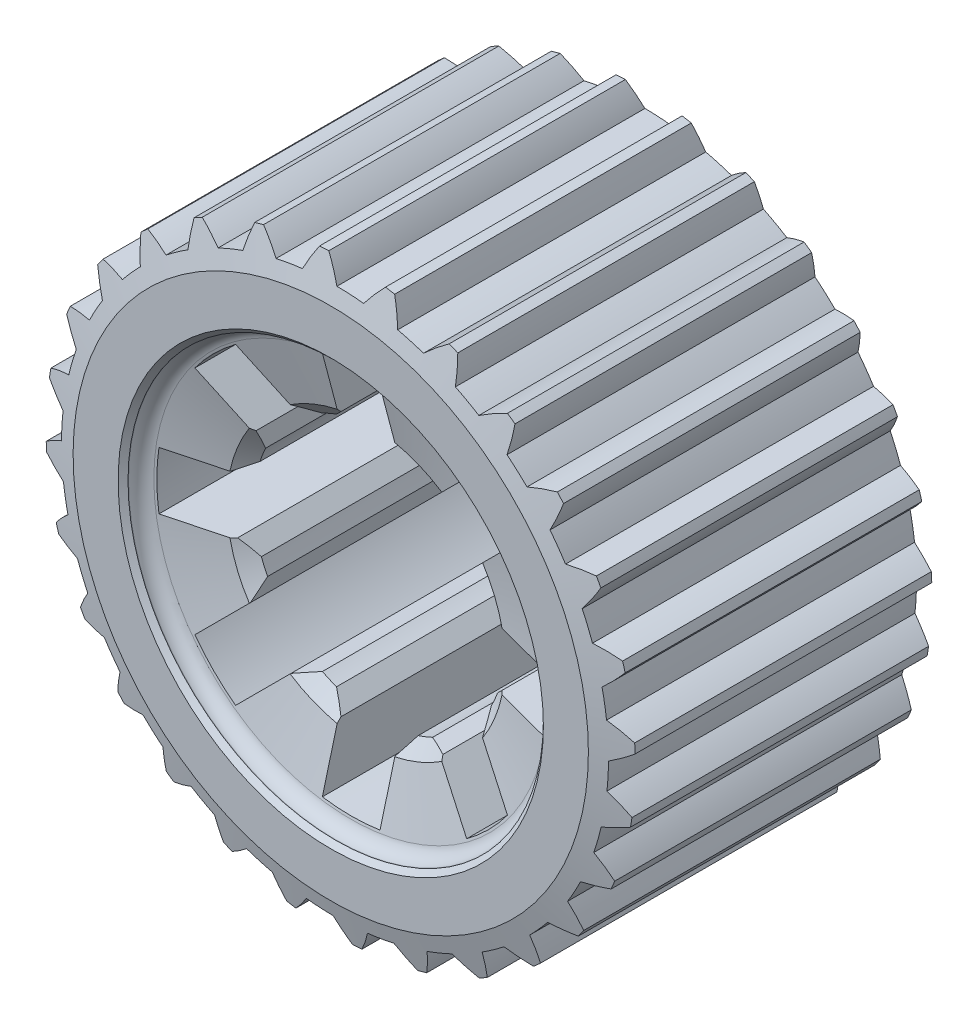
from build123d import *

# Parameters (mm, degrees)
CUT_EXTRUDE1_REACH = 54.916
CUT_EXTRUDE2_DEPTH = 32
CHAMFER1_SIZE      = 1.344493339
CHAMFER1_SIZE_2    = 1


with BuildPart() as part:
    # Sketch1 → Revolve1 (revolve)
    with BuildSketch(Plane(origin=(0, 0, 0), x_dir=(0, 0, -1), z_dir=(1, 0, 0)), mode=Mode.PRIVATE) as revolve1_sk:
        with BuildLine():
            Line((1.004809472, 29.8), (30.995190528, 29.8))
            Line((30.995190528, 29.8), (32, 26.05))
            Line((32, 26.05), (32, 21.5))
            Line((32, 21.5), (31.5, 21))
            Line((31.5, 21), (31.448888739, 21))
            ThreePointArc((31.448888739, 21), (30.535746596, 20.69003001), (30, 19.888228568))
            Line((30, 19.888228568), (28.44904883, 14.1))
            Line((28.44904883, 14.1), (27.04904883, 12.7))
            Line((27.04904883, 12.7), (4.92608004, 12.7))
            Line((4.92608004, 12.7), (3.560054636, 14.066025404))
            Line((3.560054636, 14.066025404), (2, 19.888228568))
            ThreePointArc((2, 19.888228568), (1.464253404, 20.69003001), (0.551111261, 21))
            Line((0.551111261, 21), (0.5, 21))
            Line((0.5, 21), (0, 21.5))
            Line((0, 21.5), (0, 26.05))
            Line((0, 26.05), (1.004809472, 29.8))
        make_face()
    revolve(revolve1_sk.sketch.rotate(Axis((0, 0, 0), (0, 0, -1)), 90), axis=Axis((0, 0, 0), (0, 0, -1)))

    # Cut-Extrude1: up to this face of the body (flat: up to its plane)
    cut_extrude1_end = Plane(part.part.faces().sort_by_distance((-25.313194734, 0, -32))[0])
    # Sketch2 → Cut-Extrude1 (cut, up to the picked face)
    with BuildSketch(Plane.XY, mode=Mode.PRIVATE) as cut_extrude1_sk1:
        with BuildLine():
            ThreePointArc((-12.360937464, 2.915), (-12.7, 0), (-12.360937464, -2.915))
            Line((-12.360937464, -2.915), (-19.432582819, -2.915))
            ThreePointArc((-19.432582819, -2.915), (-19.65, 0), (-19.432582819, 2.915))
            Line((-19.432582819, 2.915), (-12.360937464, 2.915))
        make_face()
    cut_extrude1_tool1 = split(extrude(cut_extrude1_sk1.sketch, amount=-CUT_EXTRUDE1_REACH, mode=Mode.PRIVATE), bisect_by=cut_extrude1_end, keep=Keep.BOTH, mode=Mode.PRIVATE)
    # Sketch2 → Cut-Extrude1 (cut, up to the picked face)
    with BuildSketch(Plane.XY, mode=Mode.PRIVATE) as cut_extrude1_sk2:
        with BuildLine():
            Line((-6.679286436, 10.80171897), (-11.67969482, 15.802127354))
            ThreePointArc((-11.67969482, 15.802127354), (-13.89464825, 13.89464825), (-15.802127354, 11.67969482))
            Line((-15.802127354, 11.67969482), (-10.80171897, 6.679286436))
            ThreePointArc((-10.80171897, 6.679286436), (-8.980256121, 8.980256121), (-6.679286436, 10.80171897))
        make_face()
    cut_extrude1_tool2 = split(extrude(cut_extrude1_sk2.sketch, amount=-CUT_EXTRUDE1_REACH, mode=Mode.PRIVATE), bisect_by=cut_extrude1_end, keep=Keep.BOTH, mode=Mode.PRIVATE)
    # Sketch2 → Cut-Extrude1 (cut, up to the picked face)
    with BuildSketch(Plane.XY, mode=Mode.PRIVATE) as cut_extrude1_sk3:
        with BuildLine():
            Line((2.915, 12.360937464), (2.915, 19.432582819))
            ThreePointArc((2.915, 19.432582819), (0, 19.65), (-2.915, 19.432582819))
            Line((-2.915, 19.432582819), (-2.915, 12.360937464))
            ThreePointArc((-2.915, 12.360937464), (0, 12.7), (2.915, 12.360937464))
        make_face()
    cut_extrude1_tool3 = split(extrude(cut_extrude1_sk3.sketch, amount=-CUT_EXTRUDE1_REACH, mode=Mode.PRIVATE), bisect_by=cut_extrude1_end, keep=Keep.BOTH, mode=Mode.PRIVATE)
    # Sketch2 → Cut-Extrude1 (cut, up to the picked face)
    with BuildSketch(Plane.XY, mode=Mode.PRIVATE) as cut_extrude1_sk4:
        with BuildLine():
            ThreePointArc((10.80171897, 6.679286436), (8.980256121, 8.980256121), (6.679286436, 10.80171897))
            Line((6.679286436, 10.80171897), (11.67969482, 15.802127354))
            ThreePointArc((11.67969482, 15.802127354), (13.89464825, 13.89464825), (15.802127354, 11.67969482))
            Line((15.802127354, 11.67969482), (10.80171897, 6.679286436))
        make_face()
    cut_extrude1_tool4 = split(extrude(cut_extrude1_sk4.sketch, amount=-CUT_EXTRUDE1_REACH, mode=Mode.PRIVATE), bisect_by=cut_extrude1_end, keep=Keep.BOTH, mode=Mode.PRIVATE)
    # Sketch2 → Cut-Extrude1 (cut, up to the picked face)
    with BuildSketch(Plane.XY, mode=Mode.PRIVATE) as cut_extrude1_sk5:
        with BuildLine():
            ThreePointArc((12.360937464, -2.915), (12.7, 0), (12.360937464, 2.915))
            Line((12.360937464, 2.915), (19.432582819, 2.915))
            ThreePointArc((19.432582819, 2.915), (19.65, 0), (19.432582819, -2.915))
            Line((19.432582819, -2.915), (12.360937464, -2.915))
        make_face()
    cut_extrude1_tool5 = split(extrude(cut_extrude1_sk5.sketch, amount=-CUT_EXTRUDE1_REACH, mode=Mode.PRIVATE), bisect_by=cut_extrude1_end, keep=Keep.BOTH, mode=Mode.PRIVATE)
    # Sketch2 → Cut-Extrude1 (cut, up to the picked face)
    with BuildSketch(Plane.XY, mode=Mode.PRIVATE) as cut_extrude1_sk6:
        with BuildLine():
            ThreePointArc((6.679286436, -10.80171897), (8.980256121, -8.980256121), (10.80171897, -6.679286436))
            Line((10.80171897, -6.679286436), (15.802127354, -11.67969482))
            ThreePointArc((15.802127354, -11.67969482), (13.89464825, -13.89464825), (11.67969482, -15.802127354))
            Line((11.67969482, -15.802127354), (6.679286436, -10.80171897))
        make_face()
    cut_extrude1_tool6 = split(extrude(cut_extrude1_sk6.sketch, amount=-CUT_EXTRUDE1_REACH, mode=Mode.PRIVATE), bisect_by=cut_extrude1_end, keep=Keep.BOTH, mode=Mode.PRIVATE)
    # Sketch2 → Cut-Extrude1 (cut, up to the picked face)
    with BuildSketch(Plane.XY, mode=Mode.PRIVATE) as cut_extrude1_sk7:
        with BuildLine():
            ThreePointArc((-2.915, -12.360937464), (0, -12.7), (2.915, -12.360937464))
            Line((2.915, -12.360937464), (2.915, -19.432582819))
            ThreePointArc((2.915, -19.432582819), (0, -19.65), (-2.915, -19.432582819))
            Line((-2.915, -19.432582819), (-2.915, -12.360937464))
        make_face()
    cut_extrude1_tool7 = split(extrude(cut_extrude1_sk7.sketch, amount=-CUT_EXTRUDE1_REACH, mode=Mode.PRIVATE), bisect_by=cut_extrude1_end, keep=Keep.BOTH, mode=Mode.PRIVATE)
    # Sketch2 → Cut-Extrude1 (cut, up to the picked face)
    with BuildSketch(Plane.XY, mode=Mode.PRIVATE) as cut_extrude1_sk8:
        with BuildLine():
            Line((-10.80171897, -6.679286436), (-15.802127354, -11.67969482))
            ThreePointArc((-15.802127354, -11.67969482), (-13.89464825, -13.89464825), (-11.67969482, -15.802127354))
            Line((-11.67969482, -15.802127354), (-6.679286436, -10.80171897))
            ThreePointArc((-6.679286436, -10.80171897), (-8.980256121, -8.980256121), (-10.80171897, -6.679286436))
        make_face()
    cut_extrude1_tool8 = split(extrude(cut_extrude1_sk8.sketch, amount=-CUT_EXTRUDE1_REACH, mode=Mode.PRIVATE), bisect_by=cut_extrude1_end, keep=Keep.BOTH, mode=Mode.PRIVATE)
    add(cut_extrude1_tool1.solids().sort_by(Axis((-16.082211, 0, 0), (0, 0, -1)))[0], mode=Mode.SUBTRACT)
    add(cut_extrude1_tool2.solids().sort_by(Axis((-11.371841, 11.371841, 0), (0, 0, -1)))[0], mode=Mode.SUBTRACT)
    add(cut_extrude1_tool3.solids().sort_by(Axis((0, 16.082211, 0), (0, 0, -1)))[0], mode=Mode.SUBTRACT)
    add(cut_extrude1_tool4.solids().sort_by(Axis((11.371841, 11.371841, 0), (0, 0, -1)))[0], mode=Mode.SUBTRACT)
    add(cut_extrude1_tool5.solids().sort_by(Axis((16.082211, 0, 0), (0, 0, -1)))[0], mode=Mode.SUBTRACT)
    add(cut_extrude1_tool6.solids().sort_by(Axis((11.371841, -11.371841, 0), (0, 0, -1)))[0], mode=Mode.SUBTRACT)
    add(cut_extrude1_tool7.solids().sort_by(Axis((0, -16.082211, 0), (0, 0, -1)))[0], mode=Mode.SUBTRACT)
    add(cut_extrude1_tool8.solids().sort_by(Axis((-11.371841, -11.371841, 0), (0, 0, -1)))[0], mode=Mode.SUBTRACT)

    # Sketch7 → Cut-Extrude2 (cut)
    with BuildSketch(Plane.XY):
        with BuildLine():
            ThreePointArc((-2.009018836, 29.932655133), (-5.024345545, 29.576273461), (-7.988205073, 28.916925488))
            add(Edge.make_bspline(
                [(-5.961745791, 26.999631241), (-6.049876785, 27.100404307), (-6.536513343, 27.64013331), (-7.212707157, 28.282593355), (-7.828108053, 28.789626611), (-7.988205073, 28.916925488)],
                knots=[0.225158607, 0.225158607, 0.225158607, 0.225158607, 0.250002323, 0.360002057, 0.397961303, 0.397961303, 0.397961303, 0.397961303], degree=3))
            ThreePointArc((-5.961745791, 26.999631241), (-4.63077181, 27.259465373), (-3.288658832, 27.453728765))
            add(Edge.make_bspline(
                [(-3.288658832, 27.453728765), (-3.238749623, 27.577951765), (-2.957644558, 28.248102852), (-2.531540395, 29.077818602), (-2.118097434, 29.759629355), (-2.009018836, 29.932655133)],
                knots=[0.225158607, 0.225158607, 0.225158607, 0.225158607, 0.250002323, 0.360002057, 0.397961303, 0.397961303, 0.397961303, 0.397961303], degree=3))
        make_face()
        with BuildLine():
            ThreePointArc((2.902824077, 27.497201901), (1.551133001, 27.606457332), (0.195710783, 27.649307356))
            add(Edge.make_bspline(
                [(0.195710783, 27.649307356), (0.132213534, 27.767164822), (-0.222121028, 28.401648514), (-0.738400442, 29.178468024), (-1.225546438, 29.80972848), (-1.353302827, 29.969460647)],
                knots=[0.225158607, 0.225158607, 0.225158607, 0.225158607, 0.250002323, 0.360002057, 0.397961303, 0.397961303, 0.397961303, 0.397961303], degree=3))
            ThreePointArc((-1.353302827, 29.969460647), (1.682965281, 29.952756599), (4.701993836, 29.629229723))
            add(Edge.make_bspline(
                [(2.902824077, 27.497201901), (2.979124175, 27.607204528), (3.402303996, 28.198001766), (4.002353961, 28.912097714), (4.55714821, 29.484814334), (4.701993836, 29.629229723)],
                knots=[0.225158607, 0.225158607, 0.225158607, 0.225158607, 0.250002323, 0.360002057, 0.397961303, 0.397961303, 0.397961303, 0.397961303], degree=3))
        make_face()
        with BuildLine():
            ThreePointArc((8.948747265, 26.161850515), (7.655257527, 26.569146245), (6.343353602, 26.912531748))
            add(Edge.make_bspline(
                [(6.343353602, 26.912531748), (6.307674114, 27.041563748), (6.103409363, 27.738986467), (5.772932755, 28.611212467), (5.438469192, 29.335046088), (5.349459673, 29.519201907)],
                knots=[0.225158607, 0.225158607, 0.225158607, 0.225158607, 0.250002323, 0.360002057, 0.397961303, 0.397961303, 0.397961303, 0.397961303], degree=3))
            ThreePointArc((5.349459673, 29.519201907), (8.305885201, 28.827283449), (11.177228904, 27.840071013))
            add(Edge.make_bspline(
                [(8.948747265, 26.161850515), (9.047612247, 26.252116778), (9.59164682, 26.733935127), (10.335553577, 27.296603519), (11.003879413, 27.731507604), (11.177228904, 27.840071013)],
                knots=[0.225158607, 0.225158607, 0.225158607, 0.225158607, 0.250002323, 0.360002057, 0.397961303, 0.397961303, 0.397961303, 0.397961303], degree=3))
        make_face()
        with BuildLine():
            ThreePointArc((14.545942898, 23.514634703), (13.375515475, 24.199547223), (12.172914183, 24.826249421))
            add(Edge.make_bspline(
                [(12.172914183, 24.826249421), (12.166841576, 24.959985752), (12.122889323, 25.685375811), (11.994786998, 26.609271247), (11.829777268, 27.389381992), (11.783977928, 27.588727121)],
                knots=[0.225158607, 0.225158607, 0.225158607, 0.225158607, 0.250002323, 0.360002057, 0.397961303, 0.397961303, 0.397961303, 0.397961303], degree=3))
            ThreePointArc((11.783977928, 27.588727121), (14.512313354, 26.256289934), (17.091991043, 24.654894893))
            add(Edge.make_bspline(
                [(14.545942898, 23.514634703), (14.662415262, 23.580638273), (15.300024421, 23.929317349), (16.150485379, 24.312343644), (16.898830154, 24.587627286), (17.091991043, 24.654894893)],
                knots=[0.225158607, 0.225158607, 0.225158607, 0.225158607, 0.250002323, 0.360002057, 0.397961303, 0.397961303, 0.397961303, 0.397961303], degree=3))
        make_face()
        with BuildLine():
            ThreePointArc((19.413744216, 19.688296918), (18.425069226, 20.616481854), (17.392074017, 21.495075282))
            add(Edge.make_bspline(
                [(17.392074017, 21.495075282), (17.415912797, 21.626809847), (17.534476992, 22.343793158), (17.615172535, 23.273030056), (17.627890914, 24.070299915), (17.627598325, 24.274838358)],
                knots=[0.225158607, 0.225158607, 0.225158607, 0.225158607, 0.250002323, 0.360002057, 0.397961303, 0.397961303, 0.397961303, 0.397961303], degree=3))
            ThreePointArc((17.627598325, 24.274838358), (19.991033518, 22.368696406), (22.149689381, 20.233419393))
            add(Edge.make_bspline(
                [(19.413744216, 19.688296918), (19.541983551, 19.726728101), (20.241194911, 19.924783679), (21.155564406, 20.108961338), (21.946402987, 20.210820667), (22.149689381, 20.233419393)],
                knots=[0.225158607, 0.225158607, 0.225158607, 0.225158607, 0.250002323, 0.360002057, 0.397961303, 0.397961303, 0.397961303, 0.397961303], degree=3))
        make_face()
        with BuildLine():
            ThreePointArc((23.308059334, 14.874705714), (22.550713069, 15.999619998), (21.739122637, 17.086048313))
            add(Edge.make_bspline(
                [(21.739122637, 17.086048313), (21.791677427, 17.20917539), (22.066812767, 17.881799417), (22.352259766, 18.769781959), (22.542068503, 19.544232492), (22.587297334, 19.743707836)],
                knots=[0.225158607, 0.225158607, 0.225158607, 0.225158607, 0.250002323, 0.360002057, 0.397961303, 0.397961303, 0.397961303, 0.397961303], degree=3))
            ThreePointArc((22.587297334, 19.743707836), (24.467319785, 17.359443036), (26.096709804, 14.797355757))
            add(Edge.make_bspline(
                [(23.308059334, 14.874705714), (23.441635184, 14.883637411), (24.167387367, 14.921138157), (25.099815095, 14.897231744), (25.893491535, 14.820559106), (26.096709804, 14.797355757)],
                knots=[0.225158607, 0.225158607, 0.225158607, 0.225158607, 0.250002323, 0.360002057, 0.397961303, 0.397961303, 0.397961303, 0.397961303], degree=3))
        make_face()
        with BuildLine():
            ThreePointArc((26.033611032, 9.315234654), (25.545569995, 10.580470387), (24.996080874, 11.820255537))
            add(Edge.make_bspline(
                [(24.996080874, 11.820255537), (25.074716357, 11.928601019), (25.492626406, 12.523137586), (25.968511358, 13.325338618), (26.32589265, 14.038135642), (26.41437494, 14.222545361)],
                knots=[0.225158607, 0.225158607, 0.225158607, 0.225158607, 0.250002323, 0.360002057, 0.397961303, 0.397961303, 0.397961303, 0.397961303], degree=3))
            ThreePointArc((26.41437494, 14.222545361), (27.716712472, 11.479714706), (28.735132227, 8.619290916))
            add(Edge.make_bspline(
                [(26.033611032, 9.315234654), (26.165825346, 9.294218992), (26.881726108, 9.169284463), (27.785456248, 8.938492744), (28.542172296, 8.687132827), (28.735132227, 8.619290916)],
                knots=[0.225158607, 0.225158607, 0.225158607, 0.225158607, 0.250002323, 0.360002057, 0.397961303, 0.397961303, 0.397961303, 0.397961303], degree=3))
        make_face()
        with BuildLine():
            ThreePointArc((27.453728765, 3.288658832), (27.259465373, 4.63077181), (26.999631241, 5.961745791))
            add(Edge.make_bspline(
                [(26.999631241, 5.961745791), (27.100404307, 6.049876785), (27.64013331, 6.536513343), (28.282593355, 7.212707157), (28.789626611, 7.828108053), (28.916925488, 7.988205073)],
                knots=[0.225158607, 0.225158607, 0.225158607, 0.225158607, 0.250002323, 0.360002057, 0.397961303, 0.397961303, 0.397961303, 0.397961303], degree=3))
            ThreePointArc((28.916925488, 7.988205073), (29.576273461, 5.024345545), (29.932655133, 2.009018836))
            add(Edge.make_bspline(
                [(27.453728765, 3.288658832), (27.577951765, 3.238749623), (28.248102852, 2.957644558), (29.077818602, 2.531540395), (29.759629355, 2.118097434), (29.932655133, 2.009018836)],
                knots=[0.225158607, 0.225158607, 0.225158607, 0.225158607, 0.250002323, 0.360002057, 0.397961303, 0.397961303, 0.397961303, 0.397961303], degree=3))
        make_face()
        with BuildLine():
            ThreePointArc((27.497201901, -2.902824077), (27.606457332, -1.551133001), (27.649307356, -0.195710783))
            add(Edge.make_bspline(
                [(27.649307356, -0.195710783), (27.767164822, -0.132213534), (28.401648514, 0.222121028), (29.178468024, 0.738400442), (29.80972848, 1.225546438), (29.969460647, 1.353302827)],
                knots=[0.225158607, 0.225158607, 0.225158607, 0.225158607, 0.250002323, 0.360002057, 0.397961303, 0.397961303, 0.397961303, 0.397961303], degree=3))
            ThreePointArc((29.969460647, 1.353302827), (29.952756599, -1.682965281), (29.629229723, -4.701993836))
            add(Edge.make_bspline(
                [(27.497201901, -2.902824077), (27.607204528, -2.979124175), (28.198001766, -3.402303996), (28.912097714, -4.002353961), (29.484814334, -4.55714821), (29.629229723, -4.701993836)],
                knots=[0.225158607, 0.225158607, 0.225158607, 0.225158607, 0.250002323, 0.360002057, 0.397961303, 0.397961303, 0.397961303, 0.397961303], degree=3))
        make_face()
        with BuildLine():
            ThreePointArc((26.161850515, -8.948747265), (26.569146245, -7.655257527), (26.912531748, -6.343353602))
            add(Edge.make_bspline(
                [(26.912531748, -6.343353602), (27.041563748, -6.307674114), (27.738986467, -6.103409363), (28.611212467, -5.772932755), (29.335046088, -5.438469192), (29.519201907, -5.349459673)],
                knots=[0.225158607, 0.225158607, 0.225158607, 0.225158607, 0.250002323, 0.360002057, 0.397961303, 0.397961303, 0.397961303, 0.397961303], degree=3))
            ThreePointArc((29.519201907, -5.349459673), (28.827283449, -8.305885201), (27.840071013, -11.177228904))
            add(Edge.make_bspline(
                [(26.161850515, -8.948747265), (26.252116778, -9.047612247), (26.733935127, -9.59164682), (27.296603519, -10.335553577), (27.731507604, -11.003879413), (27.840071013, -11.177228904)],
                knots=[0.225158607, 0.225158607, 0.225158607, 0.225158607, 0.250002323, 0.360002057, 0.397961303, 0.397961303, 0.397961303, 0.397961303], degree=3))
        make_face()
        with BuildLine():
            ThreePointArc((23.514634703, -14.545942898), (24.199547223, -13.375515475), (24.826249421, -12.172914183))
            add(Edge.make_bspline(
                [(24.826249421, -12.172914183), (24.959985752, -12.166841576), (25.685375811, -12.122889323), (26.609271247, -11.994786998), (27.389381992, -11.829777268), (27.588727121, -11.783977928)],
                knots=[0.225158607, 0.225158607, 0.225158607, 0.225158607, 0.250002323, 0.360002057, 0.397961303, 0.397961303, 0.397961303, 0.397961303], degree=3))
            ThreePointArc((27.588727121, -11.783977928), (26.256289934, -14.512313354), (24.654894893, -17.091991043))
            add(Edge.make_bspline(
                [(23.514634703, -14.545942898), (23.580638273, -14.662415262), (23.929317349, -15.300024421), (24.312343644, -16.150485379), (24.587627286, -16.898830154), (24.654894893, -17.091991043)],
                knots=[0.225158607, 0.225158607, 0.225158607, 0.225158607, 0.250002323, 0.360002057, 0.397961303, 0.397961303, 0.397961303, 0.397961303], degree=3))
        make_face()
        with BuildLine():
            ThreePointArc((19.688296918, -19.413744216), (20.616481854, -18.425069226), (21.495075282, -17.392074017))
            add(Edge.make_bspline(
                [(21.495075282, -17.392074017), (21.626809847, -17.415912797), (22.343793158, -17.534476992), (23.273030056, -17.615172535), (24.070299915, -17.627890914), (24.274838358, -17.627598325)],
                knots=[0.225158607, 0.225158607, 0.225158607, 0.225158607, 0.250002323, 0.360002057, 0.397961303, 0.397961303, 0.397961303, 0.397961303], degree=3))
            ThreePointArc((24.274838358, -17.627598325), (22.368696406, -19.991033518), (20.233419393, -22.149689381))
            add(Edge.make_bspline(
                [(19.688296918, -19.413744216), (19.726728101, -19.541983551), (19.924783679, -20.241194911), (20.108961338, -21.155564406), (20.210820667, -21.946402987), (20.233419393, -22.149689381)],
                knots=[0.225158607, 0.225158607, 0.225158607, 0.225158607, 0.250002323, 0.360002057, 0.397961303, 0.397961303, 0.397961303, 0.397961303], degree=3))
        make_face()
        with BuildLine():
            ThreePointArc((14.797355757, -26.096709804), (17.359443036, -24.467319785), (19.743707836, -22.587297334))
            add(Edge.make_bspline(
                [(17.086048313, -21.739122637), (17.20917539, -21.791677427), (17.881799417, -22.066812767), (18.769781959, -22.352259766), (19.544232492, -22.542068503), (19.743707836, -22.587297334)],
                knots=[0.225158607, 0.225158607, 0.225158607, 0.225158607, 0.250002323, 0.360002057, 0.397961303, 0.397961303, 0.397961303, 0.397961303], degree=3))
            ThreePointArc((17.086048313, -21.739122637), (15.999619998, -22.550713069), (14.874705714, -23.308059334))
            add(Edge.make_bspline(
                [(14.874705714, -23.308059334), (14.883637411, -23.441635184), (14.921138157, -24.167387367), (14.897231744, -25.099815095), (14.820559106, -25.893491535), (14.797355757, -26.096709804)],
                knots=[0.225158607, 0.225158607, 0.225158607, 0.225158607, 0.250002323, 0.360002057, 0.397961303, 0.397961303, 0.397961303, 0.397961303], degree=3))
        make_face()
        with BuildLine():
            ThreePointArc((9.315234654, -26.033611032), (10.580470387, -25.545569995), (11.820255537, -24.996080874))
            add(Edge.make_bspline(
                [(11.820255537, -24.996080874), (11.928601019, -25.074716357), (12.523137586, -25.492626406), (13.325338618, -25.968511358), (14.038135642, -26.32589265), (14.222545361, -26.41437494)],
                knots=[0.225158607, 0.225158607, 0.225158607, 0.225158607, 0.250002323, 0.360002057, 0.397961303, 0.397961303, 0.397961303, 0.397961303], degree=3))
            ThreePointArc((14.222545361, -26.41437494), (11.479714706, -27.716712472), (8.619290916, -28.735132227))
            add(Edge.make_bspline(
                [(9.315234654, -26.033611032), (9.294218992, -26.165825346), (9.169284463, -26.881726108), (8.938492744, -27.785456248), (8.687132827, -28.542172296), (8.619290916, -28.735132227)],
                knots=[0.225158607, 0.225158607, 0.225158607, 0.225158607, 0.250002323, 0.360002057, 0.397961303, 0.397961303, 0.397961303, 0.397961303], degree=3))
        make_face()
        with BuildLine():
            ThreePointArc((3.288658832, -27.453728765), (4.63077181, -27.259465373), (5.961745791, -26.999631241))
            add(Edge.make_bspline(
                [(5.961745791, -26.999631241), (6.049876785, -27.100404307), (6.536513343, -27.64013331), (7.212707157, -28.282593355), (7.828108053, -28.789626611), (7.988205073, -28.916925488)],
                knots=[0.225158607, 0.225158607, 0.225158607, 0.225158607, 0.250002323, 0.360002057, 0.397961303, 0.397961303, 0.397961303, 0.397961303], degree=3))
            ThreePointArc((7.988205073, -28.916925488), (5.024345545, -29.576273461), (2.009018836, -29.932655133))
            add(Edge.make_bspline(
                [(3.288658832, -27.453728765), (3.238749623, -27.577951765), (2.957644558, -28.248102852), (2.531540395, -29.077818602), (2.118097434, -29.759629355), (2.009018836, -29.932655133)],
                knots=[0.225158607, 0.225158607, 0.225158607, 0.225158607, 0.250002323, 0.360002057, 0.397961303, 0.397961303, 0.397961303, 0.397961303], degree=3))
        make_face()
        with BuildLine():
            ThreePointArc((-2.902824077, -27.497201901), (-1.551133001, -27.606457332), (-0.195710783, -27.649307356))
            add(Edge.make_bspline(
                [(-0.195710783, -27.649307356), (-0.132213534, -27.767164822), (0.222121028, -28.401648514), (0.738400442, -29.178468024), (1.225546438, -29.80972848), (1.353302827, -29.969460647)],
                knots=[0.225158607, 0.225158607, 0.225158607, 0.225158607, 0.250002323, 0.360002057, 0.397961303, 0.397961303, 0.397961303, 0.397961303], degree=3))
            ThreePointArc((1.353302827, -29.969460647), (-1.682965281, -29.952756599), (-4.701993836, -29.629229723))
            add(Edge.make_bspline(
                [(-2.902824077, -27.497201901), (-2.979124175, -27.607204528), (-3.402303996, -28.198001766), (-4.002353961, -28.912097714), (-4.55714821, -29.484814334), (-4.701993836, -29.629229723)],
                knots=[0.225158607, 0.225158607, 0.225158607, 0.225158607, 0.250002323, 0.360002057, 0.397961303, 0.397961303, 0.397961303, 0.397961303], degree=3))
        make_face()
        with BuildLine():
            ThreePointArc((-8.948747265, -26.161850515), (-7.655257527, -26.569146245), (-6.343353602, -26.912531748))
            add(Edge.make_bspline(
                [(-6.343353602, -26.912531748), (-6.307674114, -27.041563748), (-6.103409363, -27.738986467), (-5.772932755, -28.611212467), (-5.438469192, -29.335046088), (-5.349459673, -29.519201907)],
                knots=[0.225158607, 0.225158607, 0.225158607, 0.225158607, 0.250002323, 0.360002057, 0.397961303, 0.397961303, 0.397961303, 0.397961303], degree=3))
            ThreePointArc((-5.349459673, -29.519201907), (-8.305885201, -28.827283449), (-11.177228904, -27.840071013))
            add(Edge.make_bspline(
                [(-8.948747265, -26.161850515), (-9.047612247, -26.252116778), (-9.59164682, -26.733935127), (-10.335553577, -27.296603519), (-11.003879413, -27.731507604), (-11.177228904, -27.840071013)],
                knots=[0.225158607, 0.225158607, 0.225158607, 0.225158607, 0.250002323, 0.360002057, 0.397961303, 0.397961303, 0.397961303, 0.397961303], degree=3))
        make_face()
        with BuildLine():
            ThreePointArc((-14.545942898, -23.514634703), (-13.375515475, -24.199547223), (-12.172914183, -24.826249421))
            add(Edge.make_bspline(
                [(-12.172914183, -24.826249421), (-12.166841576, -24.959985752), (-12.122889323, -25.685375811), (-11.994786998, -26.609271247), (-11.829777268, -27.389381992), (-11.783977928, -27.588727121)],
                knots=[0.225158607, 0.225158607, 0.225158607, 0.225158607, 0.250002323, 0.360002057, 0.397961303, 0.397961303, 0.397961303, 0.397961303], degree=3))
            ThreePointArc((-11.783977928, -27.588727121), (-14.512313354, -26.256289934), (-17.091991043, -24.654894893))
            add(Edge.make_bspline(
                [(-14.545942898, -23.514634703), (-14.662415262, -23.580638273), (-15.300024421, -23.929317349), (-16.150485379, -24.312343644), (-16.898830154, -24.587627286), (-17.091991043, -24.654894893)],
                knots=[0.225158607, 0.225158607, 0.225158607, 0.225158607, 0.250002323, 0.360002057, 0.397961303, 0.397961303, 0.397961303, 0.397961303], degree=3))
        make_face()
        with BuildLine():
            ThreePointArc((-19.413744216, -19.688296918), (-18.425069226, -20.616481854), (-17.392074017, -21.495075282))
            add(Edge.make_bspline(
                [(-17.392074017, -21.495075282), (-17.415912797, -21.626809847), (-17.534476992, -22.343793158), (-17.615172535, -23.273030056), (-17.627890914, -24.070299915), (-17.627598325, -24.274838358)],
                knots=[0.225158607, 0.225158607, 0.225158607, 0.225158607, 0.250002323, 0.360002057, 0.397961303, 0.397961303, 0.397961303, 0.397961303], degree=3))
            ThreePointArc((-17.627598325, -24.274838358), (-19.991033518, -22.368696406), (-22.149689381, -20.233419393))
            add(Edge.make_bspline(
                [(-19.413744216, -19.688296918), (-19.541983551, -19.726728101), (-20.241194911, -19.924783679), (-21.155564406, -20.108961338), (-21.946402987, -20.210820667), (-22.149689381, -20.233419393)],
                knots=[0.225158607, 0.225158607, 0.225158607, 0.225158607, 0.250002323, 0.360002057, 0.397961303, 0.397961303, 0.397961303, 0.397961303], degree=3))
        make_face()
        with BuildLine():
            ThreePointArc((-23.308059334, -14.874705714), (-22.550713069, -15.999619998), (-21.739122637, -17.086048313))
            add(Edge.make_bspline(
                [(-21.739122637, -17.086048313), (-21.791677427, -17.20917539), (-22.066812767, -17.881799417), (-22.352259766, -18.769781959), (-22.542068503, -19.544232492), (-22.587297334, -19.743707836)],
                knots=[0.225158607, 0.225158607, 0.225158607, 0.225158607, 0.250002323, 0.360002057, 0.397961303, 0.397961303, 0.397961303, 0.397961303], degree=3))
            ThreePointArc((-22.587297334, -19.743707836), (-24.467319785, -17.359443036), (-26.096709804, -14.797355757))
            add(Edge.make_bspline(
                [(-23.308059334, -14.874705714), (-23.441635184, -14.883637411), (-24.167387367, -14.921138157), (-25.099815095, -14.897231744), (-25.893491535, -14.820559106), (-26.096709804, -14.797355757)],
                knots=[0.225158607, 0.225158607, 0.225158607, 0.225158607, 0.250002323, 0.360002057, 0.397961303, 0.397961303, 0.397961303, 0.397961303], degree=3))
        make_face()
        with BuildLine():
            ThreePointArc((-26.033611032, -9.315234654), (-25.545569995, -10.580470387), (-24.996080874, -11.820255537))
            add(Edge.make_bspline(
                [(-24.996080874, -11.820255537), (-25.074716357, -11.928601019), (-25.492626406, -12.523137586), (-25.968511358, -13.325338618), (-26.32589265, -14.038135642), (-26.41437494, -14.222545361)],
                knots=[0.225158607, 0.225158607, 0.225158607, 0.225158607, 0.250002323, 0.360002057, 0.397961303, 0.397961303, 0.397961303, 0.397961303], degree=3))
            ThreePointArc((-26.41437494, -14.222545361), (-27.716712472, -11.479714706), (-28.735132227, -8.619290916))
            add(Edge.make_bspline(
                [(-26.033611032, -9.315234654), (-26.165825346, -9.294218992), (-26.881726108, -9.169284463), (-27.785456248, -8.938492744), (-28.542172296, -8.687132827), (-28.735132227, -8.619290916)],
                knots=[0.225158607, 0.225158607, 0.225158607, 0.225158607, 0.250002323, 0.360002057, 0.397961303, 0.397961303, 0.397961303, 0.397961303], degree=3))
        make_face()
        with BuildLine():
            ThreePointArc((-27.453728765, -3.288658832), (-27.259465373, -4.63077181), (-26.999631241, -5.961745791))
            add(Edge.make_bspline(
                [(-26.999631241, -5.961745791), (-27.100404307, -6.049876785), (-27.64013331, -6.536513343), (-28.282593355, -7.212707157), (-28.789626611, -7.828108053), (-28.916925488, -7.988205073)],
                knots=[0.225158607, 0.225158607, 0.225158607, 0.225158607, 0.250002323, 0.360002057, 0.397961303, 0.397961303, 0.397961303, 0.397961303], degree=3))
            ThreePointArc((-28.916925488, -7.988205073), (-29.576273461, -5.024345545), (-29.932655133, -2.009018836))
            add(Edge.make_bspline(
                [(-27.453728765, -3.288658832), (-27.577951765, -3.238749623), (-28.248102852, -2.957644558), (-29.077818602, -2.531540395), (-29.759629355, -2.118097434), (-29.932655133, -2.009018836)],
                knots=[0.225158607, 0.225158607, 0.225158607, 0.225158607, 0.250002323, 0.360002057, 0.397961303, 0.397961303, 0.397961303, 0.397961303], degree=3))
        make_face()
        with BuildLine():
            ThreePointArc((-27.497201901, 2.902824077), (-27.606457332, 1.551133001), (-27.649307356, 0.195710783))
            add(Edge.make_bspline(
                [(-27.649307356, 0.195710783), (-27.767164822, 0.132213534), (-28.401648514, -0.222121028), (-29.178468024, -0.738400442), (-29.80972848, -1.225546438), (-29.969460647, -1.353302827)],
                knots=[0.225158607, 0.225158607, 0.225158607, 0.225158607, 0.250002323, 0.360002057, 0.397961303, 0.397961303, 0.397961303, 0.397961303], degree=3))
            ThreePointArc((-29.969460647, -1.353302827), (-29.952756599, 1.682965281), (-29.629229723, 4.701993836))
            add(Edge.make_bspline(
                [(-27.497201901, 2.902824077), (-27.607204528, 2.979124175), (-28.198001766, 3.402303996), (-28.912097714, 4.002353961), (-29.484814334, 4.55714821), (-29.629229723, 4.701993836)],
                knots=[0.225158607, 0.225158607, 0.225158607, 0.225158607, 0.250002323, 0.360002057, 0.397961303, 0.397961303, 0.397961303, 0.397961303], degree=3))
        make_face()
        with BuildLine():
            ThreePointArc((-26.161850515, 8.948747265), (-26.569146245, 7.655257527), (-26.912531748, 6.343353602))
            add(Edge.make_bspline(
                [(-26.912531748, 6.343353602), (-27.041563748, 6.307674114), (-27.738986467, 6.103409363), (-28.611212467, 5.772932755), (-29.335046088, 5.438469192), (-29.519201907, 5.349459673)],
                knots=[0.225158607, 0.225158607, 0.225158607, 0.225158607, 0.250002323, 0.360002057, 0.397961303, 0.397961303, 0.397961303, 0.397961303], degree=3))
            ThreePointArc((-29.519201907, 5.349459673), (-28.827283449, 8.305885201), (-27.840071013, 11.177228904))
            add(Edge.make_bspline(
                [(-26.161850515, 8.948747265), (-26.252116778, 9.047612247), (-26.733935127, 9.59164682), (-27.296603519, 10.335553577), (-27.731507604, 11.003879413), (-27.840071013, 11.177228904)],
                knots=[0.225158607, 0.225158607, 0.225158607, 0.225158607, 0.250002323, 0.360002057, 0.397961303, 0.397961303, 0.397961303, 0.397961303], degree=3))
        make_face()
        with BuildLine():
            ThreePointArc((-23.514634703, 14.545942898), (-24.199547223, 13.375515475), (-24.826249421, 12.172914183))
            add(Edge.make_bspline(
                [(-24.826249421, 12.172914183), (-24.959985752, 12.166841576), (-25.685375811, 12.122889323), (-26.609271247, 11.994786998), (-27.389381992, 11.829777268), (-27.588727121, 11.783977928)],
                knots=[0.225158607, 0.225158607, 0.225158607, 0.225158607, 0.250002323, 0.360002057, 0.397961303, 0.397961303, 0.397961303, 0.397961303], degree=3))
            ThreePointArc((-27.588727121, 11.783977928), (-26.256289934, 14.512313354), (-24.654894893, 17.091991043))
            add(Edge.make_bspline(
                [(-23.514634703, 14.545942898), (-23.580638273, 14.662415262), (-23.929317349, 15.300024421), (-24.312343644, 16.150485379), (-24.587627286, 16.898830154), (-24.654894893, 17.091991043)],
                knots=[0.225158607, 0.225158607, 0.225158607, 0.225158607, 0.250002323, 0.360002057, 0.397961303, 0.397961303, 0.397961303, 0.397961303], degree=3))
        make_face()
        with BuildLine():
            ThreePointArc((-19.688296918, 19.413744216), (-20.616481854, 18.425069226), (-21.495075282, 17.392074017))
            add(Edge.make_bspline(
                [(-21.495075282, 17.392074017), (-21.626809847, 17.415912797), (-22.343793158, 17.534476992), (-23.273030056, 17.615172535), (-24.070299915, 17.627890914), (-24.274838358, 17.627598325)],
                knots=[0.225158607, 0.225158607, 0.225158607, 0.225158607, 0.250002323, 0.360002057, 0.397961303, 0.397961303, 0.397961303, 0.397961303], degree=3))
            ThreePointArc((-24.274838358, 17.627598325), (-22.368696406, 19.991033518), (-20.233419393, 22.149689381))
            add(Edge.make_bspline(
                [(-19.688296918, 19.413744216), (-19.726728101, 19.541983551), (-19.924783679, 20.241194911), (-20.108961338, 21.155564406), (-20.210820667, 21.946402987), (-20.233419393, 22.149689381)],
                knots=[0.225158607, 0.225158607, 0.225158607, 0.225158607, 0.250002323, 0.360002057, 0.397961303, 0.397961303, 0.397961303, 0.397961303], degree=3))
        make_face()
        with BuildLine():
            ThreePointArc((-14.874705714, 23.308059334), (-15.999619998, 22.550713069), (-17.086048313, 21.739122637))
            add(Edge.make_bspline(
                [(-17.086048313, 21.739122637), (-17.20917539, 21.791677427), (-17.881799417, 22.066812767), (-18.769781959, 22.352259766), (-19.544232492, 22.542068503), (-19.743707836, 22.587297334)],
                knots=[0.225158607, 0.225158607, 0.225158607, 0.225158607, 0.250002323, 0.360002057, 0.397961303, 0.397961303, 0.397961303, 0.397961303], degree=3))
            ThreePointArc((-19.743707836, 22.587297334), (-17.359443036, 24.467319785), (-14.797355757, 26.096709804))
            add(Edge.make_bspline(
                [(-14.874705714, 23.308059334), (-14.883637411, 23.441635184), (-14.921138157, 24.167387367), (-14.897231744, 25.099815095), (-14.820559106, 25.893491535), (-14.797355757, 26.096709804)],
                knots=[0.225158607, 0.225158607, 0.225158607, 0.225158607, 0.250002323, 0.360002057, 0.397961303, 0.397961303, 0.397961303, 0.397961303], degree=3))
        make_face()
        with BuildLine():
            ThreePointArc((-9.315234654, 26.033611032), (-10.580470387, 25.545569995), (-11.820255537, 24.996080874))
            add(Edge.make_bspline(
                [(-11.820255537, 24.996080874), (-11.928601019, 25.074716357), (-12.523137586, 25.492626406), (-13.325338618, 25.968511358), (-14.038135642, 26.32589265), (-14.222545361, 26.41437494)],
                knots=[0.225158607, 0.225158607, 0.225158607, 0.225158607, 0.250002323, 0.360002057, 0.397961303, 0.397961303, 0.397961303, 0.397961303], degree=3))
            ThreePointArc((-14.222545361, 26.41437494), (-11.479714706, 27.716712472), (-8.619290916, 28.735132227))
            add(Edge.make_bspline(
                [(-9.315234654, 26.033611032), (-9.294218992, 26.165825346), (-9.169284463, 26.881726108), (-8.938492744, 27.785456248), (-8.687132827, 28.542172296), (-8.619290916, 28.735132227)],
                knots=[0.225158607, 0.225158607, 0.225158607, 0.225158607, 0.250002323, 0.360002057, 0.397961303, 0.397961303, 0.397961303, 0.397961303], degree=3))
        make_face()
    extrude(amount=-CUT_EXTRUDE2_DEPTH, mode=Mode.SUBTRACT)

    # Chamfer1
    # the kernel refuses this chamfer: 1.344493339, 1 mm, written as the material it takes off along each edge
    with BuildSketch(Plane(origin=(-6.679286436, -10.80171897, -1.449774399), x_dir=(-0.7071067811865538, -0.7071067811865412, 0), z_dir=(0, 0, -1)), Plane(origin=(2.915, -12.360937464, -1.449774399), x_dir=(0, -1, 0), z_dir=(0, 0, -1)), Plane(origin=(10.80171897, -6.679286436, -1.449774399), x_dir=(0.7071067811865374, -0.7071067811865578, 0), z_dir=(0, 0, -1)), Plane(origin=(12.360937464, 2.915, -1.449774399), x_dir=(1, 0, 0), z_dir=(0, 0, -1))) as chamfer1_piece_1:
        with BuildLine():
            Line((CHAMFER1_SIZE, 0), (-0.281119676, -1.005204356))
            ThreePointArc((-0.281119676, -1.005204356), (-0.135582865, -0.524579176), (0, 0))
            Line((0, 0), (CHAMFER1_SIZE, 0))
        make_face()
    extrude(amount=29.075580071, mode=Mode.SUBTRACT)
    with BuildSketch(Plane(origin=(-2.915, -12.360937464, -1.08718224), x_dir=(0, -1, 0), z_dir=(0, 0, -1)), Plane(origin=(6.679286436, -10.80171897, -1.08718224), x_dir=(0.707106781186544, -0.7071067811865511, 0), z_dir=(0, 0, -1)), Plane(origin=(12.360937464, -2.915, -1.08718224), x_dir=(1, 0, 0), z_dir=(0, 0, -1)), Plane(origin=(10.80171897, 6.679286436, -1.08718224), x_dir=(0.7071067811865493, 0.7071067811865458, 0), z_dir=(0, 0, -1))) as chamfer1_piece_2:
        with BuildLine():
            Line((CHAMFER1_SIZE_2, 0), (-0.425803354, 1.425803354))
            ThreePointArc((-0.425803354, 1.425803354), (-0.198811552, 0.741869329), (0, 0))
            Line((0, 0), (CHAMFER1_SIZE_2, 0))
        make_face()
    extrude(amount=29.80076439, mode=Mode.SUBTRACT)
    with BuildSketch(Plane(origin=(6.679286436, 10.80171897, -1.08718224), x_dir=(0.7071067811865489, 0.7071067811865462, 0), z_dir=(0, 0, -1)), Plane(origin=(-2.915, 12.360937464, -1.08718224), x_dir=(0, 1, 0), z_dir=(0, 0, -1)), Plane(origin=(-10.80171897, 6.679286436, -1.08718224), x_dir=(-0.707106781186539, 0.7071067811865559, 0), z_dir=(0, 0, -1)), Plane(origin=(-12.360937464, -2.915, -1.08718224), x_dir=(-1, 0, 0), z_dir=(0, 0, -1))) as chamfer1_piece_3:
        with BuildLine():
            Line((CHAMFER1_SIZE_2, 0), (-0.425803354, -1.425803354))
            ThreePointArc((-0.425803354, -1.425803354), (-0.198811552, -0.741869329), (0, 0))
            Line((0, 0), (CHAMFER1_SIZE_2, 0))
        make_face()
    extrude(amount=29.80076439, mode=Mode.SUBTRACT)
    with BuildSketch(Plane(origin=(2.915, 12.360937464, -1.449774399), x_dir=(0, 1, 0), z_dir=(0, 0, -1)), Plane(origin=(-6.679286436, 10.80171897, -1.449774399), x_dir=(-0.7071067811865387, 0.7071067811865565, 0), z_dir=(0, 0, -1)), Plane(origin=(-12.360937464, 2.915, -1.449774399), x_dir=(-1, 0, 0), z_dir=(0, 0, -1)), Plane(origin=(-10.80171897, -6.679286436, -1.449774399), x_dir=(-0.7071067811865541, -0.7071067811865409, 0), z_dir=(0, 0, -1))) as chamfer1_piece_4:
        with BuildLine():
            Line((CHAMFER1_SIZE, 0), (-0.281119676, 1.005204356))
            ThreePointArc((-0.281119676, 1.005204356), (-0.135582865, 0.524579176), (0, 0))
            Line((0, 0), (CHAMFER1_SIZE, 0))
        make_face()
    extrude(amount=29.075580071, mode=Mode.SUBTRACT)


solid = part.part
